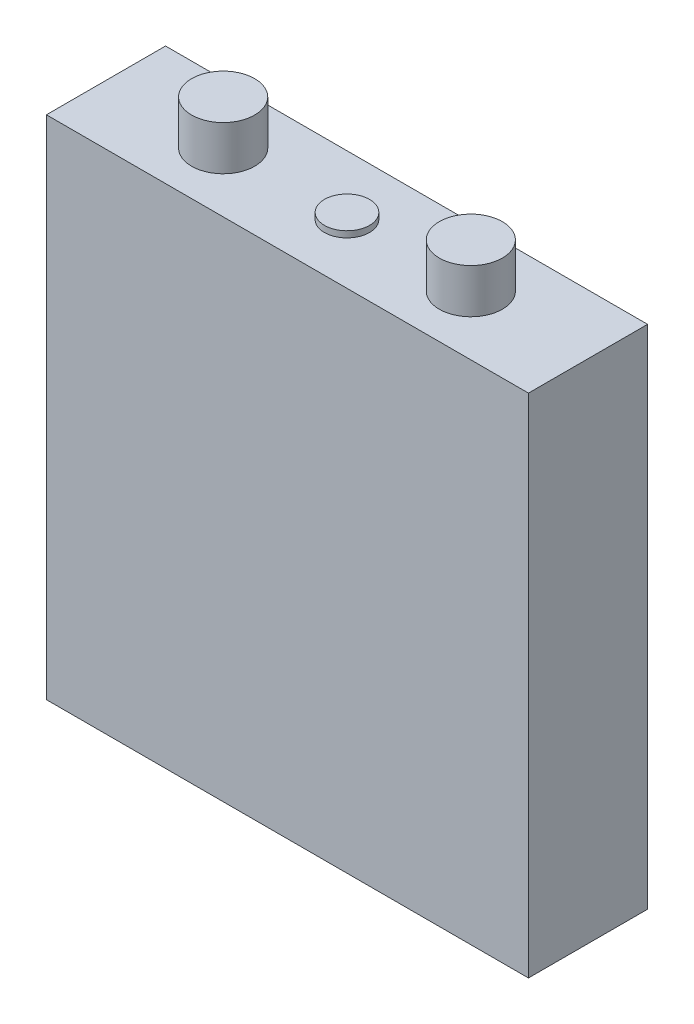
from build123d import *

# Parameters (mm, degrees)
SKETCH1_W           = 5434
SKETCH1_H           = 1343
BOSS_EXTRUDE1_DEPTH = 5710
SKETCH2_R           = 355.6
BOSS_EXTRUDE2_DEPTH = 500
SKETCH3_R           = 254
BOSS_EXTRUDE3_DEPTH = 70


with BuildPart() as part:
    # Sketch1 → Boss-Extrude1 (new body)
    with BuildSketch(Plane(origin=(0, 0, 0), x_dir=(1, 0, 0), z_dir=(0, 1, 0))):
        Rectangle(SKETCH1_W, SKETCH1_H)
    extrude(amount=BOSS_EXTRUDE1_DEPTH)

    # Sketch2 → Boss-Extrude2 (add)
    with BuildSketch(Plane(origin=(0, 5710, 0), x_dir=(1, 0, 0), z_dir=(0, 1, 0))):
        with Locations((-1396, 0)):
            Circle(SKETCH2_R)
        with Locations((1396, 0)):
            Circle(SKETCH2_R)
    extrude(amount=BOSS_EXTRUDE2_DEPTH)

    # Sketch3 → Boss-Extrude3 (add)
    with BuildSketch(Plane(origin=(0, 5710, 0), x_dir=(1, 0, 0), z_dir=(0, 1, 0))):
        Circle(SKETCH3_R)
    extrude(amount=BOSS_EXTRUDE3_DEPTH)


solid = part.part
